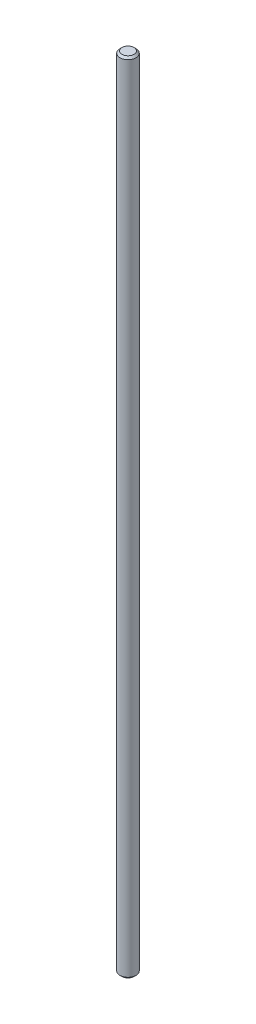
from build123d import *

# Parameters (mm, degrees)
SKETCH1_R           = 4
BOSS_EXTRUDE1_DEPTH = 400
CHAMFER1_SIZE       = 1


with BuildPart() as part:
    # Sketch1 → Boss-Extrude1 (new body)
    with BuildSketch(Plane(origin=(0, 0, 0), x_dir=(1, 0, 0), z_dir=(0, 1, 0))):
        Circle(SKETCH1_R)
    extrude(amount=BOSS_EXTRUDE1_DEPTH)

    # Chamfer1
    chamfer1_edges = [part.edges().sort_by_distance(p)[0] for p in [
        (-4, 400, 0),
        (-4, 0, 0),
    ]]
    chamfer(chamfer1_edges, length=CHAMFER1_SIZE)


solid = part.part
